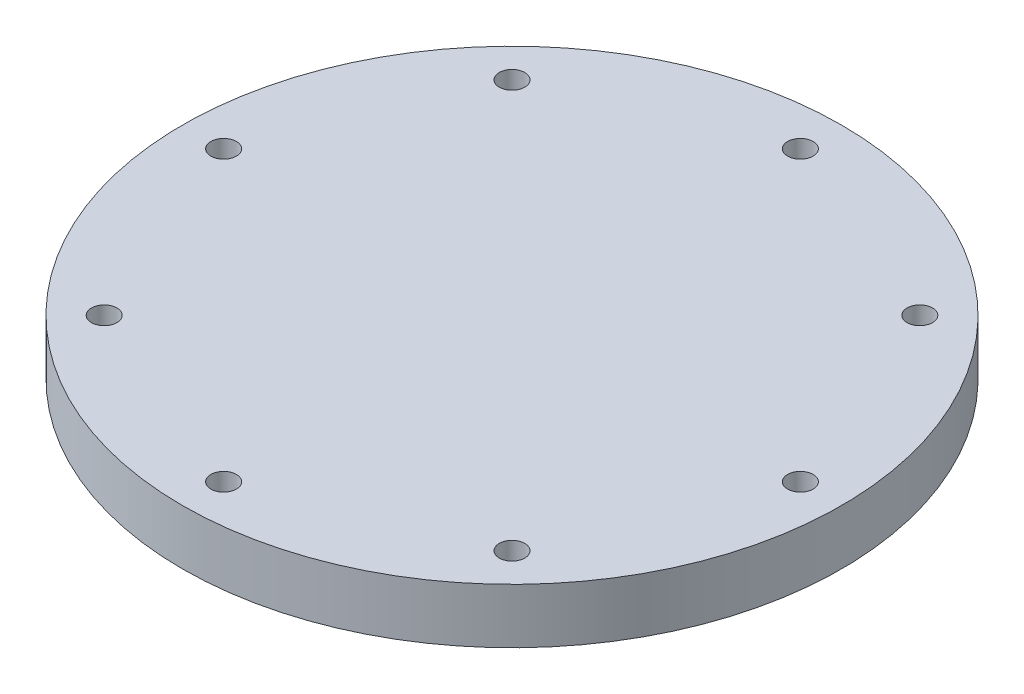
from build123d import *

# Parameters (mm, degrees)
SKETCH1_R                                      = 38.1
BOSS_EXTRUDE1_DEPTH                            = 6.35
CBORE_FOR_4_BUTTON_HEAD_CAP_SCREW1_D           = 2.9464
CBORE_FOR_4_BUTTON_HEAD_CAP_SCREW1_CBORE_D     = 5.715
CBORE_FOR_4_BUTTON_HEAD_CAP_SCREW1_CBORE_DEPTH = 1.4986
CIRPATTERN1_COUNT                              = 8


with BuildPart() as part:
    # Sketch1 → Boss-Extrude1 (new body)
    with BuildSketch(Plane(origin=(0, 0, 0), x_dir=(1, 0, 0), z_dir=(0, 1, 0))):
        Circle(SKETCH1_R)
    extrude(amount=BOSS_EXTRUDE1_DEPTH)

    # CBORE for #4 Button Head Cap Screw1 (through all)
    with Locations(Plane(origin=(0, 0, 0), x_dir=(-1, 0, 0), z_dir=(0, -1, 0))):
        with Locations((0, -33.3375)):
            cbore_for_4_button_head_cap_screw1 = CounterBoreHole(CBORE_FOR_4_BUTTON_HEAD_CAP_SCREW1_D / 2, CBORE_FOR_4_BUTTON_HEAD_CAP_SCREW1_CBORE_D / 2, CBORE_FOR_4_BUTTON_HEAD_CAP_SCREW1_CBORE_DEPTH)

    # CirPattern1: CBORE for #4 Button Head Cap Screw1 ×8 about axis
    cirpattern1_axis = Axis((0, 0, 0), (0, 1, 0))
    for i in range(1, CIRPATTERN1_COUNT):
        add(cbore_for_4_button_head_cap_screw1.rotate(cirpattern1_axis, i * 360 / CIRPATTERN1_COUNT), mode=Mode.SUBTRACT)


solid = part.part
